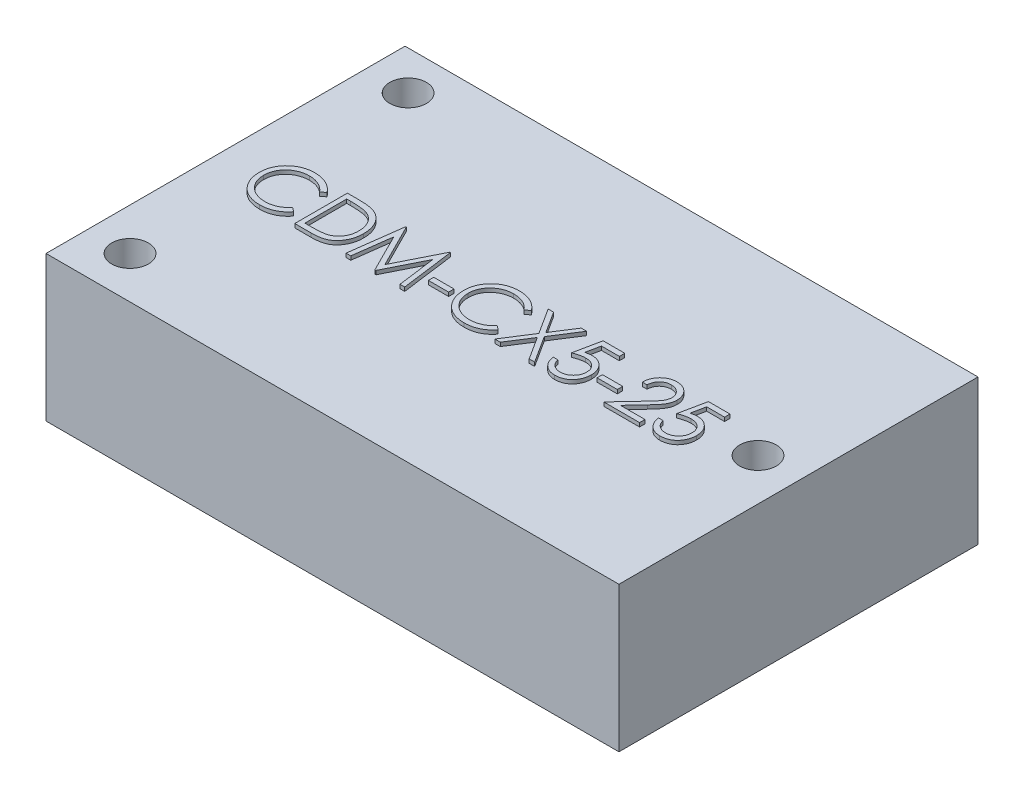
from build123d import *

# Parameters (mm, degrees)
SKETCH1_W           = 38.1
SKETCH1_H           = 23.876
SKETCH1_R           = 1.2192
BOSS_EXTRUDE1_DEPTH = 9.652
SKETCH2_W           = 1.346153846
SKETCH2_H           = 0.358974359
BOSS_EXTRUDE2_DEPTH = 0.254


with BuildPart() as part:
    # Sketch1 → Boss-Extrude1 (new body)
    with BuildSketch(Plane(origin=(0, 0, 0), x_dir=(1, 0, 0), z_dir=(0, 1, 0))):
        Rectangle(SKETCH1_W, SKETCH1_H)
        with Locations((-16.256, 9.3472)):
            Circle(SKETCH1_R, mode=Mode.SUBTRACT)
        with Locations((-16.256, -9.144)):
            Circle(SKETCH1_R, mode=Mode.SUBTRACT)
        with Locations((16.256, 0.1016)):
            Circle(SKETCH1_R, mode=Mode.SUBTRACT)
    extrude(amount=-BOSS_EXTRUDE1_DEPTH)

    # Sketch2 → Boss-Extrude2 (add)
    # profile 1 of 10: a face of its own
    with BuildSketch(Plane(origin=(0, 0, 0), x_dir=(1, 0, 0), z_dir=(0, 1, 0))):
        with BuildLine():
            Line((-12.967255042, 0.660782807), (-13.242094786, 0.450446269))
            add(Edge.make_bspline(
                [(-13.242094786, 0.450446269), (-13.261700674, 0.473812239), (-13.300648121, 0.520229154), (-13.363307324, 0.585408699), (-13.428608966, 0.64647396), (-13.496528088, 0.70371584), (-13.568287207, 0.755132606), (-13.642148006, 0.803403708), (-13.719346051, 0.846671446), (-13.826097786, 0.899134433), (-13.965745634, 0.953880588), (-14.141540473, 0.999783819), (-14.325051572, 1.029004995), (-14.450249171, 1.032169836), (-14.513929722, 1.033779602)],
                knots=[0, 0, 0, 0, 0.757959112, 1.505699292, 2.245454638, 2.979532153, 3.711538275, 4.438200793, 5.171680507, 5.909471876, 7.393775596, 8.890124382, 10.418191784, 12, 12, 12, 12], degree=3))
            add(Edge.make_bspline(
                [(-14.513929722, 1.033779602), (-14.549013021, 1.03337564), (-14.618854014, 1.032571464), (-14.722502487, 1.021962338), (-14.824215538, 1.007051128), (-14.923927005, 0.984925805), (-15.021509963, 0.956953186), (-15.117602365, 0.923527772), (-15.210812965, 0.882172932), (-15.302431203, 0.836464672), (-15.390210414, 0.784837228), (-15.473265462, 0.728523876), (-15.55129343, 0.668154779), (-15.624356042, 0.603503673), (-15.69252799, 0.534861712), (-15.755315301, 0.461497371), (-15.812500711, 0.383645197), (-15.865217736, 0.30233179), (-15.91243047, 0.217793998), (-15.951960349, 0.129718928), (-15.986965471, 0.039614825), (-16.014664714, -0.053536336), (-16.036589231, -0.149079102), (-16.051716894, -0.24726989), (-16.062205365, -0.347903569), (-16.063005542, -0.416112882), (-16.063408888, -0.450495238)],
                knots=[0, 0, 0, 0, 1.054917814, 2.100044995, 3.131103042, 4.146048494, 5.169673617, 6.183595914, 7.203665975, 8.234915748, 9.262203917, 10.264457458, 11.251630812, 12.227803204, 13.197192746, 14.159520551, 15.12972552, 16.100847026, 17.073214652, 18.039054194, 19.002613845, 19.979014051, 20.95965708, 21.949030935, 22.966165397, 24, 24, 24, 24], degree=3))
            add(Edge.make_bspline(
                [(-16.063408888, -0.450495238), (-16.062147069, -0.502226558), (-16.059669655, -0.603794142), (-16.037621321, -0.752564753), (-16.00411623, -0.895085427), (-15.953900653, -1.030465269), (-15.891981602, -1.160373627), (-15.813740991, -1.282612481), (-15.723124453, -1.399029045), (-15.618850034, -1.506871993), (-15.504444218, -1.605385718), (-15.381696306, -1.6921363), (-15.250912019, -1.764451182), (-15.113535388, -1.824627129), (-14.968509274, -1.870883856), (-14.816094472, -1.90344798), (-14.656622477, -1.92469016), (-14.547653077, -1.926723848), (-14.492194946, -1.927758859)],
                knots=[0, 0, 0, 0, 1.029171465, 2.020641659, 2.987623507, 3.938342917, 4.889210282, 5.84687017, 6.821220943, 7.821438502, 8.827599549, 9.822697543, 10.807740252, 11.797342354, 12.80366471, 13.83203677, 14.896651826, 16, 16, 16, 16], degree=3))
            add(Edge.make_bspline(
                [(-14.492194946, -1.927758859), (-14.431092257, -1.92607008), (-14.310827548, -1.922746157), (-14.134459522, -1.894586908), (-13.965623756, -1.84892899), (-13.80431117, -1.785031068), (-13.650976523, -1.70196578), (-13.505379863, -1.601267903), (-13.367398293, -1.48197957), (-13.28442701, -1.390896442), (-13.242094786, -1.344425526)],
                knots=[0, 0, 0, 0, 1.028121516, 2.023589091, 2.998037872, 3.967518031, 4.937445131, 5.927275754, 6.942489185, 8, 8, 8, 8], degree=3))
            Line((-13.242094786, -1.344425526), (-12.967255042, -1.552658699))
            add(Edge.make_bspline(
                [(-12.967255042, -1.552658699), (-12.989373152, -1.581197151), (-13.033503427, -1.638137357), (-13.104961444, -1.718409067), (-13.180238742, -1.793913103), (-13.259894452, -1.864040724), (-13.343012243, -1.930195189), (-13.431084556, -1.990497021), (-13.522953588, -2.045787905), (-13.618308067, -2.09641483), (-13.71704668, -2.141332077), (-13.819051115, -2.179785844), (-13.92388169, -2.212910734), (-14.031543199, -2.240162671), (-14.142258956, -2.261433754), (-14.25562943, -2.275653429), (-14.371899305, -2.285395344), (-14.450340726, -2.28628326), (-14.490091581, -2.286733218)],
                knots=[0, 0, 0, 0, 0.986787822, 1.968848986, 2.935600012, 3.899624008, 4.868462664, 5.837806735, 6.815139263, 7.798259679, 8.787526145, 9.778297419, 10.776456485, 11.791383307, 12.812564526, 13.85620153, 14.913611965, 16, 16, 16, 16], degree=3))
            add(Edge.make_bspline(
                [(-14.490091581, -2.286733218), (-14.527735248, -2.286471226), (-14.602170938, -2.285953168), (-14.712069689, -2.277561001), (-14.81905927, -2.266111264), (-14.922833896, -2.248871133), (-15.023959871, -2.228526793), (-15.121520456, -2.201255536), (-15.216475666, -2.170706369), (-15.308444007, -2.134801383), (-15.397503707, -2.0942852), (-15.483367518, -2.048493641), (-15.56599595, -1.997811777), (-15.646201371, -1.943356766), (-15.722798955, -1.883379464), (-15.79645248, -1.81871283), (-15.867574956, -1.749574819), (-15.911577641, -1.699719966), (-15.933701356, -1.674653892)],
                knots=[0, 0, 0, 0, 1.114604814, 2.203992996, 3.262667896, 4.300477797, 5.318619304, 6.316056647, 7.298880507, 8.271930387, 9.238335007, 10.195173496, 11.151986948, 12.108099108, 13.064862484, 14.031167946, 15.010108607, 16, 16, 16, 16], degree=3))
            add(Edge.make_bspline(
                [(-15.933701356, -1.674653892), (-15.969137, -1.631112703), (-16.039580477, -1.544555992), (-16.12970616, -1.404270011), (-16.206853715, -1.257801802), (-16.269229636, -1.104381873), (-16.317992369, -0.944354486), (-16.351773564, -0.777638972), (-16.373725169, -0.604391029), (-16.376235458, -0.486554241), (-16.377511453, -0.426657097)],
                knots=[0, 0, 0, 0, 0.994628077, 1.977248131, 2.950237994, 3.925870899, 4.908910175, 5.911660606, 6.938484602, 8, 8, 8, 8], degree=3))
            add(Edge.make_bspline(
                [(-16.377511453, -0.426657097), (-16.375956259, -0.363701643), (-16.372896513, -0.239840719), (-16.346900717, -0.058066765), (-16.305081921, 0.116084634), (-16.245685032, 0.282288378), (-16.170379681, 0.441418658), (-16.077353067, 0.592259863), (-15.967685925, 0.735776663), (-15.842238357, 0.869791414), (-15.704671022, 0.992330767), (-15.557352208, 1.100136971), (-15.400570261, 1.189854487), (-15.23605241, 1.264850649), (-15.062566728, 1.322495112), (-14.880483359, 1.362848299), (-14.690144444, 1.387965415), (-14.560282018, 1.391140623), (-14.494298311, 1.392753961)],
                knots=[0, 0, 0, 0, 1.032925535, 2.032216505, 3.007276963, 3.968222605, 4.92396291, 5.891752235, 6.871517503, 7.883894988, 8.900124299, 9.891468569, 10.874487609, 11.85992873, 12.854644235, 13.869047385, 14.917252991, 16, 16, 16, 16], degree=3))
            add(Edge.make_bspline(
                [(-14.494298311, 1.392753961), (-14.45408384, 1.392271823), (-14.374483342, 1.391317479), (-14.25673069, 1.382011337), (-14.142088363, 1.366497731), (-14.030477381, 1.345381661), (-13.921354765, 1.319174339), (-13.815554524, 1.285034041), (-13.712455837, 1.24599751), (-13.612708929, 1.201039044), (-13.516792379, 1.150572302), (-13.42473606, 1.095156679), (-13.337271201, 1.034860873), (-13.253782353, 0.970197698), (-13.175666142, 0.899799139), (-13.100704663, 0.825601543), (-13.031443585, 0.745467718), (-12.98869039, 0.689062784), (-12.967255042, 0.660782807)],
                knots=[0, 0, 0, 0, 1.096760587, 2.17092713, 3.219439832, 4.250915756, 5.268269357, 6.278326846, 7.281116186, 8.274029601, 9.260640565, 10.235837813, 11.203064059, 12.156899882, 13.114053108, 14.069676657, 15.032185724, 16, 16, 16, 16], degree=3))
        make_face()
    # profile 2 of 10: a face of its own
    with BuildSketch(Plane(origin=(0, 0, 0), x_dir=(1, 0, 0), z_dir=(0, 1, 0))):
        with BuildLine():
            Line((-12.249306324, -2.196989629), (-12.249306324, 1.303010371))
            Line((-12.249306324, 1.303010371), (-11.542575555, 1.303010371))
            add(Edge.make_bspline(
                [(-11.542575555, 1.303010371), (-11.481106567, 1.302567801), (-11.362348802, 1.301712758), (-11.190736354, 1.296291367), (-11.031952592, 1.286700901), (-10.886519733, 1.272731375), (-10.754038521, 1.255578342), (-10.634879912, 1.234077937), (-10.52842777, 1.208689767), (-10.462958329, 1.187044317), (-10.431998632, 1.176808448)],
                knots=[0, 0, 0, 0, 1.314313732, 2.53924729, 3.670748893, 4.714932338, 5.66265055, 6.526160246, 7.303039223, 8, 8, 8, 8], degree=3))
            add(Edge.make_bspline(
                [(-10.431998632, 1.176808448), (-10.391503893, 1.161377743), (-10.3114327, 1.130866249), (-10.197425578, 1.073309947), (-10.090100215, 1.008096845), (-9.98888107, 0.935140983), (-9.896080244, 0.852376634), (-9.808072347, 0.763319549), (-9.728457623, 0.664731208), (-9.655549327, 0.55865622), (-9.589813668, 0.446344168), (-9.53267451, 0.32800906), (-9.485220516, 0.204251851), (-9.44582729, 0.075416703), (-9.414780832, -0.058779674), (-9.393598901, -0.19849354), (-9.379627911, -0.34317273), (-9.378223859, -0.441347194), (-9.377511453, -0.491160302)],
                knots=[0, 0, 0, 0, 0.984719456, 1.947108742, 2.898477687, 3.838006223, 4.779231079, 5.722358779, 6.681677486, 7.655904652, 8.64651281, 9.637519902, 10.640069247, 11.656948941, 12.698408672, 13.768548281, 14.867775369, 16, 16, 16, 16], degree=3))
            add(Edge.make_bspline(
                [(-9.377511453, -0.491160302), (-9.37814042, -0.53442154), (-9.379379866, -0.619672329), (-9.390509182, -0.745313225), (-9.406685502, -0.867226796), (-9.4317297, -0.984832496), (-9.462132213, -1.099160714), (-9.501096365, -1.208992958), (-9.545731861, -1.315336768), (-9.597781739, -1.416754244), (-9.654923124, -1.512837616), (-9.716244868, -1.603413144), (-9.781681563, -1.687188366), (-9.851857196, -1.764416978), (-9.925864912, -1.834982556), (-10.004189243, -1.899474572), (-10.087032294, -1.956631127), (-10.174023016, -2.008698235), (-10.267699146, -2.05411859), (-10.369835012, -2.0925486), (-10.48086619, -2.124395215), (-10.600520147, -2.150966111), (-10.729003624, -2.172043414), (-10.86644259, -2.186169806), (-11.01262588, -2.195722739), (-11.113005145, -2.196559132), (-11.164670908, -2.196989629)],
                knots=[0, 0, 0, 0, 1.105936401, 2.179363191, 3.223086493, 4.248585256, 5.251745608, 6.245858792, 7.225916811, 8.198733463, 9.158002045, 10.082870192, 10.993790845, 11.873723703, 12.748670949, 13.606408763, 14.465103618, 15.319838547, 16.196477973, 17.123216899, 18.106603292, 19.147568657, 20.255746949, 21.433717677, 22.679120308, 24, 24, 24, 24], degree=3))
            Line((-11.164670908, -2.196989629), (-12.249306324, -2.196989629))
        make_face()
        with BuildLine():
            Line((-11.93520376, -1.83801527), (-11.533460972, -1.83801527))
            add(Edge.make_bspline(
                [(-11.533460972, -1.83801527), (-11.475732601, -1.837767173), (-11.364699803, -1.837289993), (-11.205041805, -1.83310279), (-11.059162409, -1.826260853), (-10.927040899, -1.816685775), (-10.808751875, -1.80401716), (-10.704048125, -1.789892257), (-10.613272867, -1.772294806), (-10.55834343, -1.756343847), (-10.53296017, -1.748972802)],
                knots=[0, 0, 0, 0, 1.375205317, 2.645023457, 3.804390687, 4.853969522, 5.800190428, 6.637939096, 7.370582563, 8, 8, 8, 8], degree=3))
            add(Edge.make_bspline(
                [(-10.53296017, -1.748972802), (-10.501011808, -1.737721244), (-10.43787817, -1.71548687), (-10.346997085, -1.674929209), (-10.26224008, -1.626887139), (-10.182130055, -1.573484865), (-10.1078034, -1.512838863), (-10.038379283, -1.446267875), (-9.973997482, -1.373433099), (-9.915323174, -1.294424938), (-9.86281487, -1.209735142), (-9.817343641, -1.120196309), (-9.777492109, -1.026789498), (-9.746213516, -0.92808034), (-9.721697932, -0.824951281), (-9.704333244, -0.717395068), (-9.69351852, -0.605431786), (-9.692257072, -0.529279662), (-9.691614017, -0.49045918)],
                knots=[0, 0, 0, 0, 0.998632004, 1.973411704, 2.929992603, 3.868527914, 4.809262121, 5.754881198, 6.702106254, 7.672490631, 8.653608572, 9.636854334, 10.631411391, 11.644891563, 12.686317036, 13.754757253, 14.855430412, 16, 16, 16, 16], degree=3))
            add(Edge.make_bspline(
                [(-9.691614017, -0.49045918), (-9.692127304, -0.4495257), (-9.693135662, -0.369111515), (-9.705809972, -0.25112082), (-9.724331527, -0.13764017), (-9.751115214, -0.028661974), (-9.785246092, 0.076026378), (-9.827840734, 0.175845888), (-9.876507353, 0.271850757), (-9.93441069, 0.361825123), (-9.997826284, 0.446918232), (-10.068204163, 0.524873148), (-10.144426201, 0.595867448), (-10.225661051, 0.661006761), (-10.31419815, 0.717670436), (-10.407951841, 0.768357117), (-10.508297512, 0.811373009), (-10.578110208, 0.834251872), (-10.613589177, 0.845878961)],
                knots=[0, 0, 0, 0, 1.122418816, 2.205001699, 3.251619955, 4.274784885, 5.280384055, 6.268708349, 7.249350384, 8.229342522, 9.199999885, 10.157847722, 11.105861043, 12.055065948, 13.010012805, 13.98527497, 14.976112212, 16, 16, 16, 16], degree=3))
            add(Edge.make_bspline(
                [(-10.613589177, 0.845878961), (-10.642940323, 0.853995389), (-10.705348914, 0.871253141), (-10.807188378, 0.890078514), (-10.921803527, 0.906683013), (-11.049703228, 0.920741052), (-11.190741687, 0.930828374), (-11.345027375, 0.938399688), (-11.51262698, 0.943506321), (-11.628809514, 0.943855028), (-11.68911001, 0.944036012)],
                knots=[0, 0, 0, 0, 0.674548936, 1.434276114, 2.292660221, 3.240891867, 4.284742987, 5.42552168, 6.663806718, 8, 8, 8, 8], degree=3))
            Line((-11.68911001, 0.944036012), (-11.93520376, 0.944036012))
            Line((-11.93520376, 0.944036012), (-11.93520376, -1.83801527))
        make_face(mode=Mode.SUBTRACT)
    # profile 3 of 10: a face of its own
    with BuildSketch(Plane(origin=(0, 0, 0), x_dir=(1, 0, 0), z_dir=(0, 1, 0))):
        Polygon((-8.839049914, -2.196989629), (-8.377010651, 1.303010371), (-8.332138856, 1.303010371), (-6.887126837, -1.5687845), (-5.445620427, 1.303010371), (-5.40004751, 1.303010371), (-4.93520376, -2.196989629), (-5.250708568, -2.196989629), (-5.585844786, 0.321439858), (-6.84926626, -2.196989629), (-6.920079561, -2.196989629), (-8.188408888, 0.327048833), (-8.522843985, -2.196989629), align=None)
    # profile 4 of 10: a face of its own
    with BuildSketch(Plane(origin=(0, 0, 0), x_dir=(1, 0, 0), z_dir=(0, 1, 0))):
        with Locations((-3.858280683, -0.850835783)):
            Rectangle(SKETCH2_W, SKETCH2_H)
    # profile 5 of 10: a face of its own
    with BuildSketch(Plane(origin=(0, 0, 0), x_dir=(1, 0, 0), z_dir=(0, 1, 0))):
        with BuildLine():
            Line((0.628898804, 0.660782807), (0.35405906, 0.450446269))
            add(Edge.make_bspline(
                [(0.35405906, 0.450446269), (0.334453172, 0.473812239), (0.295505725, 0.520229154), (0.232846523, 0.585408699), (0.16754488, 0.64647396), (0.099625758, 0.70371584), (0.027866639, 0.755132606), (-0.04599416, 0.803403708), (-0.123192205, 0.846671446), (-0.22994394, 0.899134433), (-0.369591788, 0.953880588), (-0.545386627, 0.999783819), (-0.728897725, 1.029004995), (-0.854095325, 1.032169836), (-0.917775876, 1.033779602)],
                knots=[0, 0, 0, 0, 0.757959112, 1.505699292, 2.245454638, 2.979532153, 3.711538275, 4.438200793, 5.171680507, 5.909471876, 7.393775596, 8.890124382, 10.418191784, 12, 12, 12, 12], degree=3))
            add(Edge.make_bspline(
                [(-0.917775876, 1.033779602), (-0.952859175, 1.03337564), (-1.022700168, 1.032571464), (-1.126348641, 1.021962338), (-1.228061692, 1.007051128), (-1.327773158, 0.984925805), (-1.425356117, 0.956953186), (-1.521448519, 0.923527772), (-1.614659119, 0.882172932), (-1.706277357, 0.836464672), (-1.794056568, 0.784837228), (-1.877111616, 0.728523876), (-1.955139584, 0.668154779), (-2.028202196, 0.603503673), (-2.096374144, 0.534861712), (-2.159161455, 0.461497371), (-2.216346865, 0.383645197), (-2.26906389, 0.30233179), (-2.316276624, 0.217793998), (-2.355806503, 0.129718928), (-2.390811625, 0.039614825), (-2.418510868, -0.053536336), (-2.440435385, -0.149079102), (-2.455563048, -0.24726989), (-2.466051519, -0.347903569), (-2.466851696, -0.416112882), (-2.467255042, -0.450495238)],
                knots=[0, 0, 0, 0, 1.054917814, 2.100044995, 3.131103042, 4.146048494, 5.169673617, 6.183595914, 7.203665975, 8.234915748, 9.262203917, 10.264457458, 11.251630812, 12.227803204, 13.197192746, 14.159520551, 15.12972552, 16.100847026, 17.073214652, 18.039054194, 19.002613845, 19.979014051, 20.95965708, 21.949030935, 22.966165397, 24, 24, 24, 24], degree=3))
            add(Edge.make_bspline(
                [(-2.467255042, -0.450495238), (-2.465993223, -0.502226558), (-2.463515809, -0.603794142), (-2.441467475, -0.752564753), (-2.407962384, -0.895085427), (-2.357746807, -1.030465269), (-2.295827756, -1.160373627), (-2.217587145, -1.282612481), (-2.126970607, -1.399029045), (-2.022696188, -1.506871993), (-1.908290372, -1.605385718), (-1.78554246, -1.6921363), (-1.654758172, -1.764451182), (-1.517381542, -1.824627129), (-1.372355428, -1.870883856), (-1.219940626, -1.90344798), (-1.060468631, -1.92469016), (-0.951499231, -1.926723848), (-0.8960411, -1.927758859)],
                knots=[0, 0, 0, 0, 1.029171465, 2.020641659, 2.987623507, 3.938342917, 4.889210282, 5.84687017, 6.821220943, 7.821438502, 8.827599549, 9.822697543, 10.807740252, 11.797342354, 12.80366471, 13.83203677, 14.896651826, 16, 16, 16, 16], degree=3))
            add(Edge.make_bspline(
                [(-0.8960411, -1.927758859), (-0.834938411, -1.92607008), (-0.714673702, -1.922746157), (-0.538305676, -1.894586908), (-0.36946991, -1.84892899), (-0.208157324, -1.785031068), (-0.054822677, -1.70196578), (0.090773983, -1.601267903), (0.228755553, -1.48197957), (0.311726836, -1.390896442), (0.35405906, -1.344425526)],
                knots=[0, 0, 0, 0, 1.028121516, 2.023589091, 2.998037872, 3.967518031, 4.937445131, 5.927275754, 6.942489185, 8, 8, 8, 8], degree=3))
            Line((0.35405906, -1.344425526), (0.628898804, -1.552658699))
            add(Edge.make_bspline(
                [(0.628898804, -1.552658699), (0.606780694, -1.581197151), (0.562650419, -1.638137357), (0.491192402, -1.718409067), (0.415915104, -1.793913103), (0.336259394, -1.864040724), (0.253141603, -1.930195189), (0.16506929, -1.990497021), (0.073200258, -2.045787905), (-0.022154221, -2.09641483), (-0.120892834, -2.141332077), (-0.222897269, -2.179785844), (-0.327727844, -2.212910734), (-0.435389353, -2.240162671), (-0.546105109, -2.261433754), (-0.659475584, -2.275653429), (-0.775745459, -2.285395344), (-0.85418688, -2.28628326), (-0.893937735, -2.286733218)],
                knots=[0, 0, 0, 0, 0.986787822, 1.968848986, 2.935600012, 3.899624008, 4.868462664, 5.837806735, 6.815139263, 7.798259679, 8.787526145, 9.778297419, 10.776456485, 11.791383307, 12.812564526, 13.85620153, 14.913611965, 16, 16, 16, 16], degree=3))
            add(Edge.make_bspline(
                [(-0.893937735, -2.286733218), (-0.931581402, -2.286471226), (-1.006017092, -2.285953168), (-1.115915843, -2.277561001), (-1.222905424, -2.266111264), (-1.32668005, -2.248871133), (-1.427806025, -2.228526793), (-1.52536661, -2.201255536), (-1.62032182, -2.170706369), (-1.712290161, -2.134801383), (-1.80134986, -2.0942852), (-1.887213672, -2.048493641), (-1.969842104, -1.997811777), (-2.050047525, -1.943356766), (-2.126645109, -1.883379464), (-2.200298634, -1.81871283), (-2.27142111, -1.749574819), (-2.315423795, -1.699719966), (-2.33754751, -1.674653892)],
                knots=[0, 0, 0, 0, 1.114604814, 2.203992996, 3.262667896, 4.300477797, 5.318619304, 6.316056647, 7.298880507, 8.271930387, 9.238335007, 10.195173496, 11.151986948, 12.108099108, 13.064862484, 14.031167946, 15.010108607, 16, 16, 16, 16], degree=3))
            add(Edge.make_bspline(
                [(-2.33754751, -1.674653892), (-2.372983154, -1.631112703), (-2.443426631, -1.544555992), (-2.533552314, -1.404270011), (-2.610699869, -1.257801802), (-2.67307579, -1.104381873), (-2.721838523, -0.944354486), (-2.755619718, -0.777638972), (-2.777571323, -0.604391029), (-2.780081612, -0.486554241), (-2.781357606, -0.426657097)],
                knots=[0, 0, 0, 0, 0.994628077, 1.977248131, 2.950237994, 3.925870899, 4.908910175, 5.911660606, 6.938484602, 8, 8, 8, 8], degree=3))
            add(Edge.make_bspline(
                [(-2.781357606, -0.426657097), (-2.779802413, -0.363701643), (-2.776742667, -0.239840719), (-2.750746871, -0.058066765), (-2.708928075, 0.116084634), (-2.649531186, 0.282288378), (-2.574225835, 0.441418658), (-2.481199221, 0.592259863), (-2.371532079, 0.735776663), (-2.246084511, 0.869791414), (-2.108517176, 0.992330767), (-1.961198362, 1.100136971), (-1.804416415, 1.189854487), (-1.639898563, 1.264850649), (-1.466412882, 1.322495112), (-1.284329513, 1.362848299), (-1.093990598, 1.387965415), (-0.964128172, 1.391140623), (-0.898144465, 1.392753961)],
                knots=[0, 0, 0, 0, 1.032925535, 2.032216505, 3.007276963, 3.968222605, 4.92396291, 5.891752235, 6.871517503, 7.883894988, 8.900124299, 9.891468569, 10.874487609, 11.85992873, 12.854644235, 13.869047385, 14.917252991, 16, 16, 16, 16], degree=3))
            add(Edge.make_bspline(
                [(-0.898144465, 1.392753961), (-0.857929993, 1.392271823), (-0.778329496, 1.391317479), (-0.660576844, 1.382011337), (-0.545934517, 1.366497731), (-0.434323535, 1.345381661), (-0.325200918, 1.319174339), (-0.219400678, 1.285034041), (-0.116301991, 1.24599751), (-0.016555083, 1.201039044), (0.079361468, 1.150572302), (0.171417786, 1.095156679), (0.258882645, 1.034860873), (0.342371493, 0.970197698), (0.420487704, 0.899799139), (0.495449183, 0.825601543), (0.564710261, 0.745467718), (0.607463456, 0.689062784), (0.628898804, 0.660782807)],
                knots=[0, 0, 0, 0, 1.096760587, 2.17092713, 3.219439832, 4.250915756, 5.268269357, 6.278326846, 7.281116186, 8.274029601, 9.260640565, 10.235837813, 11.203064059, 12.156899882, 13.114053108, 14.069676657, 15.032185724, 16, 16, 16, 16], degree=3))
        make_face()
    # profile 6 of 10: a face of its own
    with BuildSketch(Plane(origin=(0, 0, 0), x_dir=(1, 0, 0), z_dir=(0, 1, 0))):
        Polygon((1.10005265, 1.303010371), (1.462532618, 1.303010371), (2.378898804, -0.128680334), (3.29526499, 1.303010371), (3.657744958, 1.303010371), (2.560489349, -0.411933539), (3.702616753, -2.196989629), (3.340136785, -2.196989629), (2.378898804, -0.695186744), (1.417660823, -2.196989629), (1.055180855, -2.196989629), (2.198009381, -0.411933539), align=None)
    # profile 7 of 10: a face of its own
    with BuildSketch(Plane(origin=(0, 0, 0), x_dir=(1, 0, 0), z_dir=(0, 1, 0))):
        with BuildLine():
            Line((6.193001368, 1.303010371), (6.193001368, 0.944036012))
            Line((6.193001368, 0.944036012), (5.00249656, 0.944036012))
            Line((5.00249656, 0.944036012), (4.813894797, 0.023463096))
            add(Edge.make_bspline(
                [(4.813894797, 0.023463096), (4.850950672, 0.033693367), (4.922740568, 0.053512901), (5.028700429, 0.075518672), (5.129292632, 0.088784116), (5.194568003, 0.090595426), (5.226154413, 0.09147191)],
                knots=[0, 0, 0, 0, 1.100273476, 2.13160584, 3.095893838, 4, 4, 4, 4], degree=3))
            add(Edge.make_bspline(
                [(5.226154413, 0.09147191), (5.265238153, 0.090625974), (5.34208655, 0.088962653), (5.454525497, 0.072990804), (5.56185839, 0.047850889), (5.66386076, 0.012730367), (5.760721311, -0.032179366), (5.851548872, -0.088279306), (5.937706785, -0.153812637), (6.017649379, -0.229157649), (6.090173688, -0.312079266), (6.153939677, -0.401237137), (6.208102267, -0.495764799), (6.251663022, -0.596565408), (6.286447357, -0.702524561), (6.309599351, -0.814757144), (6.32501606, -0.932205264), (6.326738447, -1.012509834), (6.327616753, -1.053459981)],
                knots=[0, 0, 0, 0, 1.052922333, 2.070308379, 3.05430497, 4.020497103, 4.973039431, 5.925935799, 6.892292201, 7.88610001, 8.88166317, 9.857072816, 10.836096531, 11.812156883, 12.81219415, 13.836441305, 14.89672472, 16, 16, 16, 16], degree=3))
            add(Edge.make_bspline(
                [(6.327616753, -1.053459981), (6.326951677, -1.081982202), (6.325630515, -1.138641189), (6.318911927, -1.22278539), (6.305976211, -1.305148223), (6.288608487, -1.385740615), (6.266066069, -1.464409987), (6.238777015, -1.541381515), (6.205380988, -1.616176122), (6.168749612, -1.689501517), (6.127503134, -1.759700024), (6.081724627, -1.82534901), (6.033359136, -1.887433292), (5.98131775, -1.945287025), (5.925116755, -1.998530043), (5.865436788, -2.047478324), (5.802754069, -2.092959655), (5.736098827, -2.13312785), (5.666956344, -2.170090806), (5.594328127, -2.200414343), (5.519867426, -2.227524871), (5.442502551, -2.249134399), (5.362408738, -2.266066953), (5.279453963, -2.277567554), (5.194073293, -2.285943992), (5.13619828, -2.286468348), (5.106963708, -2.286733218)],
                knots=[0, 0, 0, 0, 1.056347294, 2.098418968, 3.122841568, 4.141288669, 5.149314143, 6.15115421, 7.162517403, 8.180376062, 9.185164535, 10.17417709, 11.141909838, 12.097768115, 13.052685741, 14.0056014, 14.954263652, 15.917497458, 16.885230207, 17.854509472, 18.828990115, 19.81800267, 20.826176721, 21.857883937, 22.917946725, 24, 24, 24, 24], degree=3))
            add(Edge.make_bspline(
                [(5.106963708, -2.286733218), (5.072089527, -2.28604238), (5.003478696, -2.284683238), (4.902958129, -2.270464753), (4.806243524, -2.250100837), (4.714113422, -2.219464567), (4.625742159, -2.181077272), (4.542319441, -2.132561101), (4.461713665, -2.077581997), (4.387201628, -2.012701644), (4.318045515, -1.941785962), (4.256139006, -1.864828321), (4.201005429, -1.783098879), (4.153527682, -1.696200725), (4.113029661, -1.604362194), (4.081214672, -1.507239193), (4.055536318, -1.405339189), (4.044672897, -1.335185678), (4.039155214, -1.299553731)],
                knots=[0, 0, 0, 0, 1.0467383, 2.05933395, 3.04377827, 4.011590433, 4.970194871, 5.932262533, 6.905835911, 7.896367577, 8.894135286, 9.877477877, 10.858688626, 11.851381753, 12.8477658, 13.868841284, 14.917554742, 16, 16, 16, 16], degree=3))
            Line((4.039155214, -1.299553731), (4.353257778, -1.299553731))
            add(Edge.make_bspline(
                [(4.353257778, -1.299553731), (4.360986336, -1.332930184), (4.375841052, -1.397081579), (4.408446801, -1.48721292), (4.448312676, -1.567532144), (4.495717025, -1.639101727), (4.552267055, -1.701510724), (4.616796484, -1.757127786), (4.689144207, -1.807302915), (4.769537437, -1.849125683), (4.854350516, -1.884794436), (4.943117726, -1.908546131), (5.033422073, -1.925247024), (5.094500443, -1.926918785), (5.125192874, -1.927758859)],
                knots=[0, 0, 0, 0, 1.136247022, 2.183929868, 3.172523383, 4.106158343, 5.02341133, 5.958108904, 6.928429099, 7.938127109, 8.96079061, 9.975095812, 10.982467395, 12, 12, 12, 12], degree=3))
            add(Edge.make_bspline(
                [(5.125192874, -1.927758859), (5.155151319, -1.926938082), (5.214139741, -1.925321963), (5.300951128, -1.912882951), (5.384764002, -1.89372538), (5.464751359, -1.865055525), (5.542312898, -1.830210806), (5.615486669, -1.785495731), (5.686389546, -1.734035712), (5.752817679, -1.675079082), (5.813657129, -1.610109387), (5.86741325, -1.540631994), (5.912190163, -1.466515147), (5.949924272, -1.389041995), (5.978577571, -1.307363437), (5.999018552, -1.221862262), (6.011021611, -1.132327282), (6.012672791, -1.071257972), (6.013514189, -1.040138667)],
                knots=[0, 0, 0, 0, 1.027316725, 2.022795036, 3.002884548, 3.971462791, 4.93288096, 5.914575861, 6.907176829, 7.935150275, 8.956128384, 9.956726525, 10.942570165, 11.921478529, 12.907843606, 13.90538589, 14.932640048, 16, 16, 16, 16], degree=3))
            add(Edge.make_bspline(
                [(6.013514189, -1.040138667), (6.012855709, -1.012062916), (6.011566829, -0.957108626), (6.001036259, -0.87670942), (5.982719287, -0.800636378), (5.957295407, -0.728522144), (5.925015899, -0.660298701), (5.885569587, -0.595895641), (5.838216189, -0.536161808), (5.7841243, -0.481069254), (5.724866259, -0.43022438), (5.659422516, -0.386880293), (5.58916259, -0.350416375), (5.51493299, -0.318948377), (5.434968092, -0.296347632), (5.350851459, -0.279379746), (5.261674751, -0.269564384), (5.200704063, -0.268202495), (5.169363547, -0.267502449)],
                knots=[0, 0, 0, 0, 1.045622112, 2.046656509, 3.013763289, 3.955457236, 4.890082067, 5.820317437, 6.762574623, 7.722996705, 8.69280354, 9.665887285, 10.63943826, 11.638615906, 12.663482002, 13.728887084, 14.832589034, 16, 16, 16, 16], degree=3))
            add(Edge.make_bspline(
                [(5.169363547, -0.267502449), (5.142234619, -0.26808304), (5.086220263, -0.269281814), (5.000297437, -0.278108311), (4.910005714, -0.292347605), (4.815691218, -0.311933853), (4.71707071, -0.337564929), (4.614352309, -0.36827943), (4.507320043, -0.405001429), (4.435202318, -0.432733642), (4.398129573, -0.446989629)],
                knots=[0, 0, 0, 0, 0.817624296, 1.688186739, 2.600797293, 3.572016777, 4.590301741, 5.671205678, 6.80286297, 8, 8, 8, 8], degree=3))
            Line((4.398129573, -0.446989629), (4.757103932, 1.303010371))
            Line((4.757103932, 1.303010371), (6.193001368, 1.303010371))
        make_face()
    # profile 8 of 10: a face of its own
    with BuildSketch(Plane(origin=(0, 0, 0), x_dir=(1, 0, 0), z_dir=(0, 1, 0))):
        with Locations((7.359668035, -0.850835783)):
            Rectangle(SKETCH2_W, SKETCH2_H)
    # profile 9 of 10: a face of its own
    with BuildSketch(Plane(origin=(0, 0, 0), x_dir=(1, 0, 0), z_dir=(0, 1, 0))):
        with BuildLine():
            Line((8.750693676, 0.226087294), (8.436591112, 0.226087294))
            add(Edge.make_bspline(
                [(8.436591112, 0.226087294), (8.438638265, 0.267758182), (8.442658819, 0.349598697), (8.461487108, 0.468922603), (8.488427985, 0.582977402), (8.526519439, 0.690847316), (8.573825717, 0.793486123), (8.630555744, 0.890486139), (8.697749595, 0.981477327), (8.773956329, 1.065616171), (8.856724968, 1.142803742), (8.946030907, 1.209458984), (9.039875935, 1.265776656), (9.137975334, 1.312857898), (9.241435897, 1.348197743), (9.349318755, 1.374419383), (9.462097891, 1.390195729), (9.538937913, 1.391891514), (9.578017394, 1.392753961)],
                knots=[0, 0, 0, 0, 1.10065271, 2.161652631, 3.183658789, 4.190468796, 5.17591951, 6.163126047, 7.15150782, 8.156236427, 9.156009102, 10.134482811, 11.092018607, 12.041330605, 13.001268258, 13.972401359, 14.968799086, 16, 16, 16, 16], degree=3))
            add(Edge.make_bspline(
                [(9.578017394, 1.392753961), (9.616395468, 1.391855505), (9.691807012, 1.39009007), (9.801869027, 1.374929041), (9.906646321, 1.351183449), (10.005934088, 1.317868033), (10.098940152, 1.273083605), (10.186363197, 1.219286067), (10.269244008, 1.157066235), (10.343850791, 1.083812422), (10.412358871, 1.005610037), (10.471461126, 0.922122134), (10.522074289, 0.835892848), (10.564261969, 0.746264646), (10.595318108, 0.652393618), (10.618896316, 0.555646415), (10.63222373, 0.455021604), (10.634269153, 0.386915048), (10.63530906, 0.352289217)],
                knots=[0, 0, 0, 0, 1.111607364, 2.184268762, 3.212621178, 4.221274766, 5.211760367, 6.196651075, 7.1921475, 8.207485113, 9.220403448, 10.201281604, 11.166441695, 12.114753415, 13.065576456, 14.026450734, 14.996634279, 16, 16, 16, 16], degree=3))
            add(Edge.make_bspline(
                [(10.63530906, 0.352289217), (10.633615797, 0.303541383), (10.630258986, 0.206901169), (10.60154461, 0.064886306), (10.556698098, -0.072707113), (10.502700742, -0.183444415), (10.448228298, -0.272677908), (10.39914079, -0.346146613), (10.341675979, -0.425252082), (10.274997481, -0.509729419), (10.200484609, -0.600240324), (10.117462445, -0.69673012), (10.025338963, -0.798201889), (9.960680463, -0.867507491), (9.927176047, -0.903419917)],
                knots=[0, 0, 0, 0, 1.184426356, 2.348067706, 3.509069118, 4.696110526, 5.333549288, 6.050745305, 6.844228056, 7.710549037, 8.667450064, 9.695053472, 10.805634456, 12, 12, 12, 12], degree=3))
            Line((9.927176047, -0.903419917), (9.051474926, -1.83801527))
            Line((9.051474926, -1.83801527), (10.680180855, -1.83801527))
            Line((10.680180855, -1.83801527), (10.680180855, -2.196989629))
            Line((10.680180855, -2.196989629), (8.301975727, -2.196989629))
            Line((8.301975727, -2.196989629), (9.659347522, -0.748472))
            add(Edge.make_bspline(
                [(9.659347522, -0.748472), (9.692395409, -0.713973694), (9.755873636, -0.647709507), (9.845656213, -0.550966547), (9.926295201, -0.461217006), (9.998312594, -0.378630458), (10.060146099, -0.30199889), (10.115018331, -0.233804187), (10.158983922, -0.171049736), (10.206699318, -0.098309122), (10.252913299, -0.009496805), (10.292625655, 0.099036884), (10.316840504, 0.210764137), (10.319745339, 0.286266174), (10.321206496, 0.324244346)],
                knots=[0, 0, 0, 0, 1.329631726, 2.553950428, 3.673215718, 4.687767853, 5.603093632, 6.413772471, 7.123043292, 7.734684054, 8.834405432, 9.900288307, 10.943827018, 12, 12, 12, 12], degree=3))
            add(Edge.make_bspline(
                [(10.321206496, 0.324244346), (10.320570754, 0.348125744), (10.319317828, 0.395191394), (10.30826013, 0.464197153), (10.291549624, 0.530761967), (10.267604366, 0.595090586), (10.235997626, 0.656536238), (10.197524246, 0.715173719), (10.153134183, 0.771862684), (10.101782914, 0.825015982), (10.045371394, 0.873697187), (9.985777144, 0.916821273), (9.92272704, 0.952860384), (9.856486918, 0.982403881), (9.787241448, 1.005579262), (9.714856703, 1.021637841), (9.639532687, 1.031720325), (9.588099191, 1.033084497), (9.561891592, 1.033779602)],
                knots=[0, 0, 0, 0, 0.991446411, 1.95395049, 2.89581595, 3.838931463, 4.798493298, 5.75982156, 6.748411868, 7.785213223, 8.824556874, 9.840280684, 10.836137867, 11.835679398, 12.848801643, 13.863922112, 14.911575587, 16, 16, 16, 16], degree=3))
            add(Edge.make_bspline(
                [(9.561891592, 1.033779602), (9.53452076, 1.03306457), (9.480768963, 1.031660365), (9.40184993, 1.021837701), (9.326564153, 1.00489186), (9.25472225, 0.981715186), (9.186202664, 0.952256637), (9.12133862, 0.915564892), (9.060275731, 0.871781399), (9.002899208, 0.822140843), (8.950035228, 0.766873242), (8.903588353, 0.705263278), (8.863004338, 0.638435863), (8.827595105, 0.566571313), (8.798839415, 0.489017533), (8.776866264, 0.406049828), (8.759479418, 0.318028446), (8.753670897, 0.257243361), (8.750693676, 0.226087294)],
                knots=[0, 0, 0, 0, 1.031018746, 2.02475058, 2.990194455, 3.934040569, 4.864654155, 5.795059489, 6.735614925, 7.690564532, 8.649604399, 9.611025574, 10.590972636, 11.591080095, 12.624614302, 13.701020113, 14.821632451, 16, 16, 16, 16], degree=3))
        make_face()
    # profile 10 of 10: a face of its own
    with BuildSketch(Plane(origin=(0, 0, 0), x_dir=(1, 0, 0), z_dir=(0, 1, 0))):
        with BuildLine():
            Line((13.193001368, 1.303010371), (13.193001368, 0.944036012))
            Line((13.193001368, 0.944036012), (12.00249656, 0.944036012))
            Line((12.00249656, 0.944036012), (11.813894797, 0.023463096))
            add(Edge.make_bspline(
                [(11.813894797, 0.023463096), (11.850950672, 0.033693367), (11.922740568, 0.053512901), (12.028700429, 0.075518672), (12.129292632, 0.088784116), (12.194568003, 0.090595426), (12.226154413, 0.09147191)],
                knots=[0, 0, 0, 0, 1.100273476, 2.13160584, 3.095893838, 4, 4, 4, 4], degree=3))
            add(Edge.make_bspline(
                [(12.226154413, 0.09147191), (12.265238153, 0.090625974), (12.34208655, 0.088962653), (12.454525497, 0.072990804), (12.56185839, 0.047850889), (12.66386076, 0.012730367), (12.760721311, -0.032179366), (12.851548872, -0.088279306), (12.937706785, -0.153812637), (13.017649379, -0.229157649), (13.090173688, -0.312079266), (13.153939677, -0.401237137), (13.208102267, -0.495764799), (13.251663022, -0.596565408), (13.286447357, -0.702524561), (13.309599351, -0.814757144), (13.32501606, -0.932205264), (13.326738447, -1.012509834), (13.327616753, -1.053459981)],
                knots=[0, 0, 0, 0, 1.052922333, 2.070308379, 3.05430497, 4.020497103, 4.973039431, 5.925935799, 6.892292201, 7.88610001, 8.88166317, 9.857072816, 10.836096531, 11.812156883, 12.81219415, 13.836441305, 14.89672472, 16, 16, 16, 16], degree=3))
            add(Edge.make_bspline(
                [(13.327616753, -1.053459981), (13.326951677, -1.081982202), (13.325630515, -1.138641189), (13.318911927, -1.22278539), (13.305976211, -1.305148223), (13.288608487, -1.385740615), (13.266066069, -1.464409987), (13.238777015, -1.541381515), (13.205380988, -1.616176122), (13.168749612, -1.689501517), (13.127503134, -1.759700024), (13.081724627, -1.82534901), (13.033359136, -1.887433292), (12.98131775, -1.945287025), (12.925116755, -1.998530043), (12.865436788, -2.047478324), (12.802754069, -2.092959655), (12.736098827, -2.13312785), (12.666956344, -2.170090806), (12.594328127, -2.200414343), (12.519867426, -2.227524871), (12.442502551, -2.249134399), (12.362408738, -2.266066953), (12.279453963, -2.277567554), (12.194073293, -2.285943992), (12.13619828, -2.286468348), (12.106963708, -2.286733218)],
                knots=[0, 0, 0, 0, 1.056347294, 2.098418968, 3.122841568, 4.141288669, 5.149314143, 6.15115421, 7.162517403, 8.180376062, 9.185164535, 10.17417709, 11.141909838, 12.097768115, 13.052685741, 14.0056014, 14.954263652, 15.917497458, 16.885230207, 17.854509472, 18.828990115, 19.81800267, 20.826176721, 21.857883937, 22.917946725, 24, 24, 24, 24], degree=3))
            add(Edge.make_bspline(
                [(12.106963708, -2.286733218), (12.072089527, -2.28604238), (12.003478696, -2.284683238), (11.902958129, -2.270464753), (11.806243524, -2.250100837), (11.714113422, -2.219464567), (11.625742159, -2.181077272), (11.542319441, -2.132561101), (11.461713665, -2.077581997), (11.387201628, -2.012701644), (11.318045515, -1.941785962), (11.256139006, -1.864828321), (11.201005429, -1.783098879), (11.153527682, -1.696200725), (11.113029661, -1.604362194), (11.081214672, -1.507239193), (11.055536318, -1.405339189), (11.044672897, -1.335185678), (11.039155214, -1.299553731)],
                knots=[0, 0, 0, 0, 1.0467383, 2.05933395, 3.04377827, 4.011590433, 4.970194871, 5.932262533, 6.905835911, 7.896367577, 8.894135286, 9.877477877, 10.858688626, 11.851381753, 12.8477658, 13.868841284, 14.917554742, 16, 16, 16, 16], degree=3))
            Line((11.039155214, -1.299553731), (11.353257778, -1.299553731))
            add(Edge.make_bspline(
                [(11.353257778, -1.299553731), (11.360986336, -1.332930184), (11.375841052, -1.397081579), (11.408446801, -1.48721292), (11.448312676, -1.567532144), (11.495717025, -1.639101727), (11.552267055, -1.701510724), (11.616796484, -1.757127786), (11.689144207, -1.807302915), (11.769537437, -1.849125683), (11.854350516, -1.884794436), (11.943117726, -1.908546131), (12.033422073, -1.925247024), (12.094500443, -1.926918785), (12.125192874, -1.927758859)],
                knots=[0, 0, 0, 0, 1.136247022, 2.183929868, 3.172523383, 4.106158343, 5.02341133, 5.958108904, 6.928429099, 7.938127109, 8.96079061, 9.975095812, 10.982467395, 12, 12, 12, 12], degree=3))
            add(Edge.make_bspline(
                [(12.125192874, -1.927758859), (12.155151319, -1.926938082), (12.214139741, -1.925321963), (12.300951128, -1.912882951), (12.384764002, -1.89372538), (12.464751359, -1.865055525), (12.542312898, -1.830210806), (12.615486669, -1.785495731), (12.686389546, -1.734035712), (12.752817679, -1.675079082), (12.813657129, -1.610109387), (12.86741325, -1.540631994), (12.912190163, -1.466515147), (12.949924272, -1.389041995), (12.978577571, -1.307363437), (12.999018552, -1.221862262), (13.011021611, -1.132327282), (13.012672791, -1.071257972), (13.013514189, -1.040138667)],
                knots=[0, 0, 0, 0, 1.027316725, 2.022795036, 3.002884548, 3.971462791, 4.93288096, 5.914575861, 6.907176829, 7.935150275, 8.956128384, 9.956726525, 10.942570165, 11.921478529, 12.907843606, 13.90538589, 14.932640048, 16, 16, 16, 16], degree=3))
            add(Edge.make_bspline(
                [(13.013514189, -1.040138667), (13.012855709, -1.012062916), (13.011566829, -0.957108626), (13.001036259, -0.87670942), (12.982719287, -0.800636378), (12.957295407, -0.728522144), (12.925015899, -0.660298701), (12.885569587, -0.595895641), (12.838216189, -0.536161808), (12.7841243, -0.481069254), (12.724866259, -0.43022438), (12.659422516, -0.386880293), (12.58916259, -0.350416375), (12.51493299, -0.318948377), (12.434968092, -0.296347632), (12.350851459, -0.279379746), (12.261674751, -0.269564384), (12.200704063, -0.268202495), (12.169363547, -0.267502449)],
                knots=[0, 0, 0, 0, 1.045622112, 2.046656509, 3.013763289, 3.955457236, 4.890082067, 5.820317437, 6.762574623, 7.722996705, 8.69280354, 9.665887285, 10.63943826, 11.638615906, 12.663482002, 13.728887084, 14.832589034, 16, 16, 16, 16], degree=3))
            add(Edge.make_bspline(
                [(12.169363547, -0.267502449), (12.142234619, -0.26808304), (12.086220263, -0.269281814), (12.000297437, -0.278108311), (11.910005714, -0.292347605), (11.815691218, -0.311933853), (11.71707071, -0.337564929), (11.614352309, -0.36827943), (11.507320043, -0.405001429), (11.435202318, -0.432733642), (11.398129573, -0.446989629)],
                knots=[0, 0, 0, 0, 0.817624296, 1.688186739, 2.600797293, 3.572016777, 4.590301741, 5.671205678, 6.80286297, 8, 8, 8, 8], degree=3))
            Line((11.398129573, -0.446989629), (11.757103932, 1.303010371))
            Line((11.757103932, 1.303010371), (13.193001368, 1.303010371))
        make_face()
    extrude(amount=BOSS_EXTRUDE2_DEPTH)


solid = part.part
